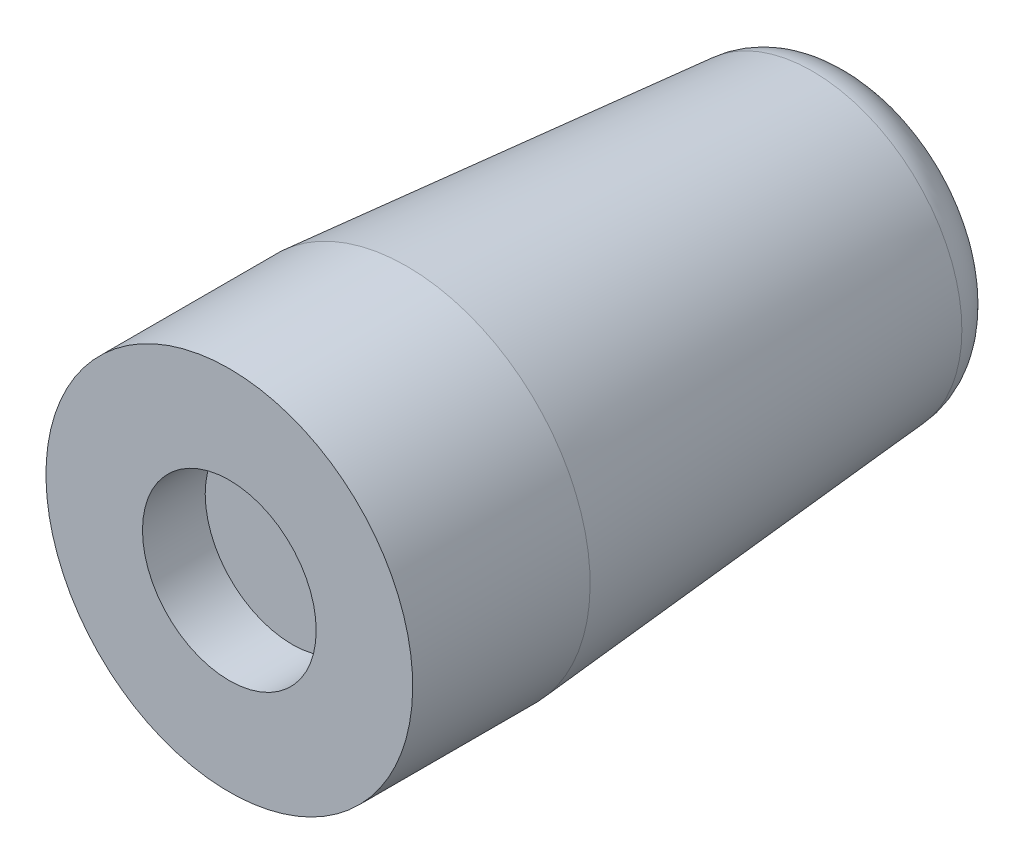
from build123d import *

# Parameters (mm, degrees)
SKETCH_5_R          = 1.8
CUT_EXTRUDE_2_DEPTH = 1.3
FILLET_1_R          = 1
SKETCH_6_R          = 1.693988814
CUT_EXTRUDE_3_DEPTH = 0.5
FILLET_2_R          = 1


with BuildPart() as part:
    # 草图1 → 旋转1 (revolve)
    with BuildSketch(Plane(origin=(0, 0, 0), x_dir=(0, 0, -1), z_dir=(1, 0, 0))):
        Polygon((6.186687636, 3.02056076), (6.186687636, 0), (-6.813312364, 0), (-6.813312364, 3.8), (-3.136442493, 3.8), align=None)
    revolve(axis=Axis((0, 0, -6.352286977), (0, 0, 1)))

    # 草图5 → 切除-拉伸2 (cut)
    with BuildSketch(Plane.XY.offset(6.813312364)):
        Circle(SKETCH_5_R)
    extrude(amount=-CUT_EXTRUDE_2_DEPTH, mode=Mode.SUBTRACT)

    # 圆角1
    fillet_1_edges = [part.edges().sort_by_distance(p)[0] for p in [
        (0, -3.02056076, -6.186687636),
    ]]
    fillet(fillet_1_edges, radius=FILLET_1_R)

    # 草图6 → 切除-拉伸3 (cut)
    with BuildSketch(Plane(origin=(0, 0, -6.186687636), x_dir=(-1, 0, 0), z_dir=(0, 0, -1))):
        with Locations(Location((0, 0, 0), (0, 0, 90))):
            Circle(SKETCH_6_R)
    extrude(amount=-CUT_EXTRUDE_3_DEPTH, mode=Mode.SUBTRACT)

    # 圆角2
    # the kernel refuses this fillet: 1 mm, written as the material it adds along each edge
    with BuildSketch(Plane(origin=(0, 0, -5.686687636), x_dir=(0, 1, 0), z_dir=(-1, 0, 0))) as fillet_2_piece_1:
        with BuildLine():
            CenterArc((0.82796341, 1), FILLET_2_R, 270, 60)
            Line((0.82796341, 0), (0.82796341, -0.02))
            Line((0.82796341, -0.02), (1.693988814, -0.02))
            Line((1.693988814, -0.02), (1.713988814, 0))
            ThreePointArc((1.713988814, 0), (1.713988814, 0.25), (1.711309322, 0.49))
            Line((1.711309322, 0.49), (1.693988814, 0.5))
        make_face()
    revolve(axis=Axis((0, 0, -5.686687636), (0, 0, -1)))


solid = part.part
